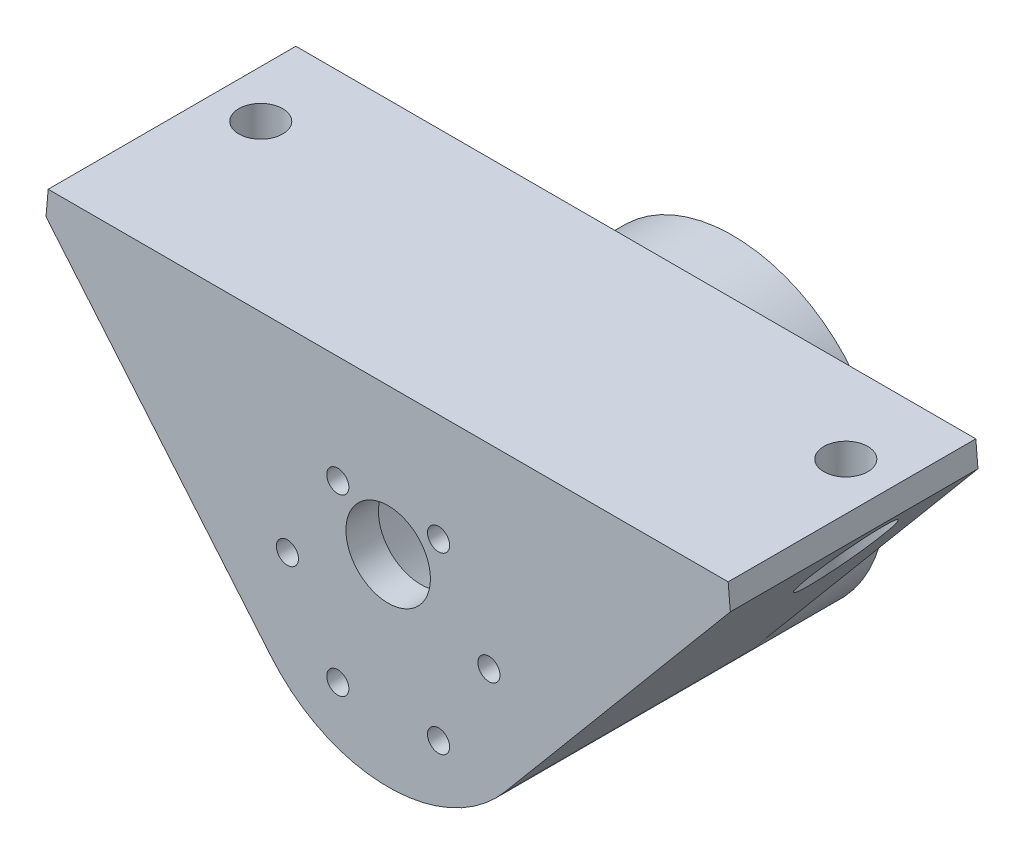
from build123d import *
from OCP.BRepFilletAPI import BRepFilletAPI_MakeChamfer

# Parameters (mm, degrees)
SKETCH1_R               = 23.5
SKETCH1_R_2             = 18.5
BOSS_EXTRUDE1_DEPTH     = 48
BOSS_EXTRUDE2_START     = 5
SKETCH1_3_R             = 23.5
SKETCH1_3_R_2           = 6.5
BOSS_EXTRUDE2_DEPTH     = 5
M3_CLEARANCE_HOLE1_D    = 3.4
CIRPATTERN1_COUNT       = 6
BOSS_EXTRUDE3_DEPTH     = 38.1
F_1_4_CLEARANCE_HOLE1_D = 6.7564
SKETCH9_R               = 5.715
CUT_EXTRUDE1_DEPTH      = 89.178677855
CHAMFER1_SIZE           = 5
CHAMFER1_SIZE2          = 3.549039071


with BuildPart() as part:
    # Sketch1 → Boss-Extrude1 (new body)
    with BuildSketch(Plane.XY):
        Circle(SKETCH1_R)
        Circle(SKETCH1_R_2, mode=Mode.SUBTRACT)
    extrude(amount=-BOSS_EXTRUDE1_DEPTH)

    # Sketch1<3> → Boss-Extrude2 (add)
    with BuildSketch(Plane.XY.offset(BOSS_EXTRUDE2_START)):
        Circle(SKETCH1_3_R)
        with Locations((0, 7.5)):
            Circle(SKETCH1_3_R_2, mode=Mode.SUBTRACT)
    extrude(amount=-BOSS_EXTRUDE2_DEPTH)

    # M3 Clearance Hole1 (through all)
    with Locations(Plane.XY.offset(5)):
        with Locations((-15.5, 0)):
            m3_clearance_hole1 = Hole(M3_CLEARANCE_HOLE1_D / 2)

    # CirPattern1: M3 Clearance Hole1 ×6 about axis
    cirpattern1_axis = Axis((0, 0, -48), (0, 0, 1))
    for i in range(1, CIRPATTERN1_COUNT):
        add(m3_clearance_hole1.rotate(cirpattern1_axis, i * 360 / CIRPATTERN1_COUNT), mode=Mode.SUBTRACT)

    # Sketch5 → Boss-Extrude3 (add)
    with BuildSketch(Plane.XY.offset(5)):
        with BuildLine():
            Line((55.850060235, 30), (-55.850060235, 30))
            Line((-55.850060235, 30), (-18.002044413, -15.105508828))
            ThreePointArc((-18.002044413, -15.105508828), (-8.037473368, 22.082776588), (23.5, 0))
            ThreePointArc((23.5, 0), (22.082776588, -8.037473368), (18.002044413, -15.105508828))
            Line((18.002044413, -15.105508828), (55.850060235, 30))
        make_face()
    extrude(amount=-BOSS_EXTRUDE3_DEPTH)

    # 1/4 Clearance Hole1 (through all)
    with Locations(Plane(origin=(0, 30, 0), x_dir=(1, 0, 0), z_dir=(0, 1, 0))):
        with Locations((-45, 20.4), (45, 20.4)):
            Hole(F_1_4_CLEARANCE_HOLE1_D / 2)

    # Sketch9 → Cut-Extrude1 (cut, through all)
    with BuildSketch(Plane(origin=(0, 25, 0), x_dir=(1, 0, 0), z_dir=(0, 1, 0))):
        with Locations((-45, 20.4)):
            Circle(SKETCH9_R)
        with Locations((45, 20.4)):
            Circle(SKETCH9_R)
    extrude(amount=-CUT_EXTRUDE1_DEPTH, mode=Mode.SUBTRACT)

    # Chamfer1: one chamfer whose edges measure the first distance from different faces: ONE call of the kernel's chamfer builder (chamfer() names one face for all edges)
    chamfer1_edges_1 = [part.edges().sort_by_distance(p)[0] for p in [
        (55.850060235, 30, -14.05),
    ]]
    chamfer1_side_1 = [part.faces().sort_by_distance(p)[0] for p in [
        (36.307526824, 6.710115599, -13.56354194),
    ]]
    chamfer1_edges_2 = [part.edges().sort_by_distance(p)[0] for p in [
        (-55.850060235, 30, -14.05),
    ]]
    chamfer1_side_2 = [part.faces().sort_by_distance(p)[0] for p in [
        (-36.307526824, 6.710115599, -13.56354194),
    ]]
    chamfer1 = BRepFilletAPI_MakeChamfer(part.part.solid().wrapped)
    for e in chamfer1_edges_1:
        chamfer1.Add(CHAMFER1_SIZE, CHAMFER1_SIZE2, e.wrapped, chamfer1_side_1[0].wrapped)  # the first distance lies on this face
    for e in chamfer1_edges_2:
        chamfer1.Add(CHAMFER1_SIZE, CHAMFER1_SIZE2, e.wrapped, chamfer1_side_2[0].wrapped)  # the first distance lies on this face
    add(Compound.cast(chamfer1.Shape()), mode=Mode.REPLACE)


solid = part.part
